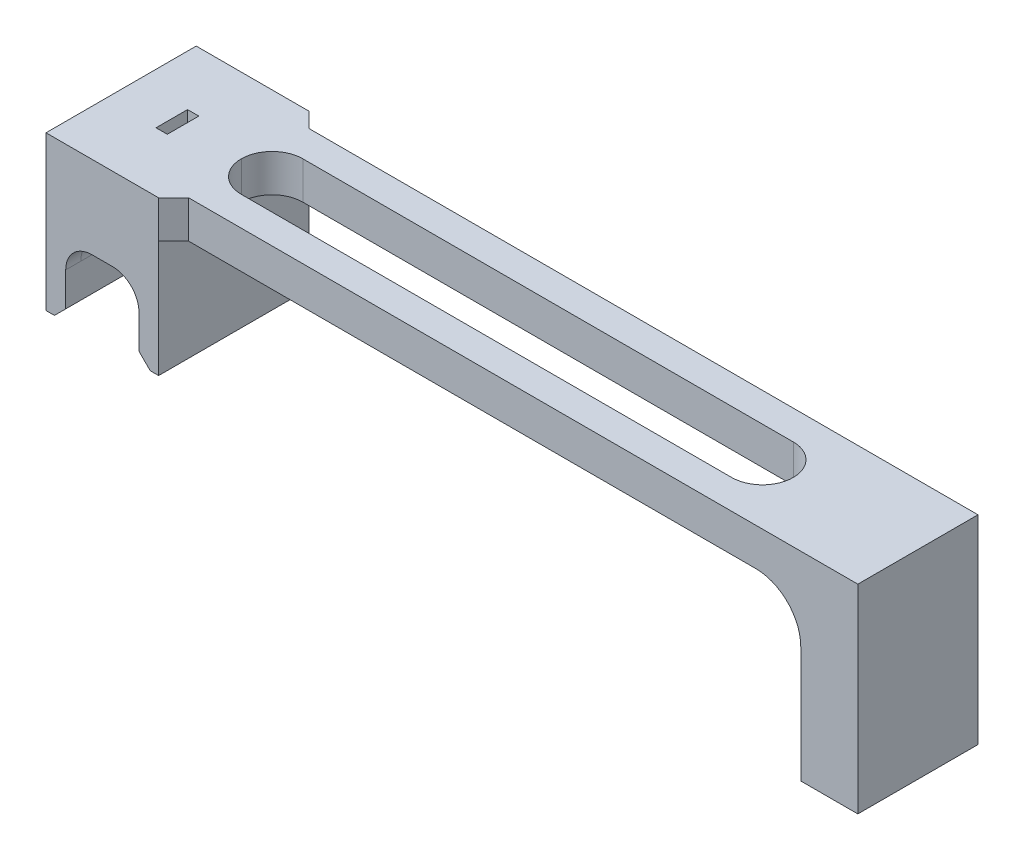
from build123d import *

# Parameters (mm, degrees)
EXTRUDE_1_DEPTH      = 16
SKETCH_4_W           = 1.5
SKETCH_4_H           = 4.2
SKETCH_4_W_2         = 73.5
SKETCH_4_H_2         = 8.2
CUT_EXTRUDE_1_DEPTH  = 10
FILLET_1_R           = 4.1
SKETCH_6_W           = 10
SKETCH_6_H           = 16
SKETCH_6_W_2         = 1.5
SKETCH_6_H_2         = 4.2
EXTRUDE_4_DEPTH      = 11
EXTRUDE_6_DEPTH      = 13
EXTRUDE_6_DEPTH_BACK = 11
SKETCH_10_W          = 0.125
SKETCH_10_H          = 16
SKETCH_10_W_2        = 2.5
FILLET_2_R           = 3.5
FILLET_3_R           = 6
EXTRUDE_7_DEPTH      = 2
EXTRUDE_8_DEPTH      = 2
FILLET_4_R           = 3.5
CUT_EXTRUDE_START    = -15
SKETCH_13_W          = 20
SKETCH_13_H          = 3.5
CUT_EXTRUDE_2_DEPTH  = 15
CHAMFER_1_SIZE       = 2
CHAMFER_2_SIZE       = 1.5


with BuildPart() as part:
    # 스케치1 → 보스-돌출1 (new body)
    with BuildSketch(Plane.XY):
        Polygon((-96, 0), (0, 0), (0, -21.5), (7.6, -21.5), (7.6, 5), (-96, 5), align=None)
    extrude(amount=EXTRUDE_1_DEPTH)

    # 스케치4 → 컷-돌출1 (cut)
    with BuildSketch(Plane.XZ):
        with Locations((-91, 8)):
            Rectangle(SKETCH_4_W, SKETCH_4_H)
        with Locations((-45.75, 8)):
            Rectangle(SKETCH_4_W_2, SKETCH_4_H_2)
    extrude(amount=-CUT_EXTRUDE_1_DEPTH, mode=Mode.SUBTRACT)

    # 필렛1
    fillet_1_edges = [part.edges().sort_by_distance(p)[0] for p in [
        (-82.5, 2.5, 3.9),
        (-82.5, 2.5, 12.1),
        (-9, 2.5, 3.9),
        (-9, 2.5, 12.1),
    ]]
    fillet(fillet_1_edges, radius=FILLET_1_R - 0.0001)  # a hair under: the kernel refuses the full size

    # 스케치6 → 보스-돌출4 (add)
    with BuildSketch(Plane(origin=(0, 5, 0), x_dir=(1, 0, 0), z_dir=(0, 1, 0))):
        with Locations((-91, -8)):
            Rectangle(SKETCH_6_W, SKETCH_6_H)
        with Locations((-91, -8)):
            Rectangle(SKETCH_6_W_2, SKETCH_6_H_2, mode=Mode.SUBTRACT)
    extrude(amount=-EXTRUDE_4_DEPTH)

    # 스케치10 → 보스-돌출6 (add, two sides: drawn at the far end of the back side and taken through both)
    with BuildSketch(Plane.XZ.offset(6).offset(-EXTRUDE_6_DEPTH_BACK)):
        with Locations((-95.9375, 8)):
            Rectangle(SKETCH_10_W, SKETCH_10_H)
        with Locations((-97.25, 8)):
            Rectangle(SKETCH_10_W_2, SKETCH_10_H)
        with Locations((-86.0625, 8)):
            Rectangle(SKETCH_10_W, SKETCH_10_H)
        with Locations((-84.75, 8)):
            Rectangle(SKETCH_10_W_2, SKETCH_10_H)
    extrude(amount=EXTRUDE_6_DEPTH + EXTRUDE_6_DEPTH_BACK)

    # 필렛2
    fillet_2_edges = [part.edges().sort_by_distance(p)[0] for p in [
        (-95.875, -6, 8),
        (-86.125, -6, 8),
    ]]
    fillet(fillet_2_edges, radius=FILLET_2_R)

    # 필렛3
    fillet_3_edges = [part.edges().sort_by_distance(p)[0] for p in [
        (0, 0, 8),
    ]]
    fillet(fillet_3_edges, radius=FILLET_3_R)

    # 스케치11 → 보스-돌출7 (add)
    with BuildSketch(Plane.XY.offset(16)):
        Polygon((-98.5, 5), (-98.5, -19), (-95.875, -19), (-95.875, -6), (-86.125, -6), (-86.125, -19), (-83.5, -19), (-83.5, 5), align=None)
    extrude(amount=EXTRUDE_7_DEPTH)

    # 스케치12 → 보스-돌출8 (add)
    with BuildSketch(Plane(origin=(0, 0, 0), x_dir=(-1, 0, 0), z_dir=(0, 0, -1))):
        Polygon((83.5, 5), (83.5, -19), (86.125, -19), (86.125, -6), (95.875, -6), (95.875, -19), (98.5, -19), (98.5, 5), align=None)
    extrude(amount=EXTRUDE_8_DEPTH)

    # 필렛4
    fillet_4_edges = [part.edges().sort_by_distance(p)[0] for p in [
        (-95.875, -6, -1),
        (-86.125, -6, -1),
        (-86.125, -6, 17),
        (-95.875, -6, 17),
    ]]
    fillet(fillet_4_edges, radius=FILLET_4_R)

    # 스케치13 → 컷-돌출2 (cut)
    with BuildSketch(Plane.ZY.offset(98.5).offset(CUT_EXTRUDE_START)):
        with Locations((8, -17.25)):
            Rectangle(SKETCH_13_W, SKETCH_13_H)
    extrude(amount=CUT_EXTRUDE_2_DEPTH, mode=Mode.SUBTRACT)

    # 모따기1
    chamfer_1_edges = [part.edges().sort_by_distance(p)[0] for p in [
        (-83.5, 2.5, 16),
        (-83.5, 2.5, 0),
    ]]
    chamfer(chamfer_1_edges, length=CHAMFER_1_SIZE - 0.0001)  # a hair under: the kernel refuses the full size

    # 모따기2
    chamfer_2_edges = [part.edges().sort_by_distance(p)[0] for p in [
        (-95.875, -15.5, 8),
        (-86.125, -15.5, 8),
    ]]
    chamfer(chamfer_2_edges, length=CHAMFER_2_SIZE)


solid = part.part
